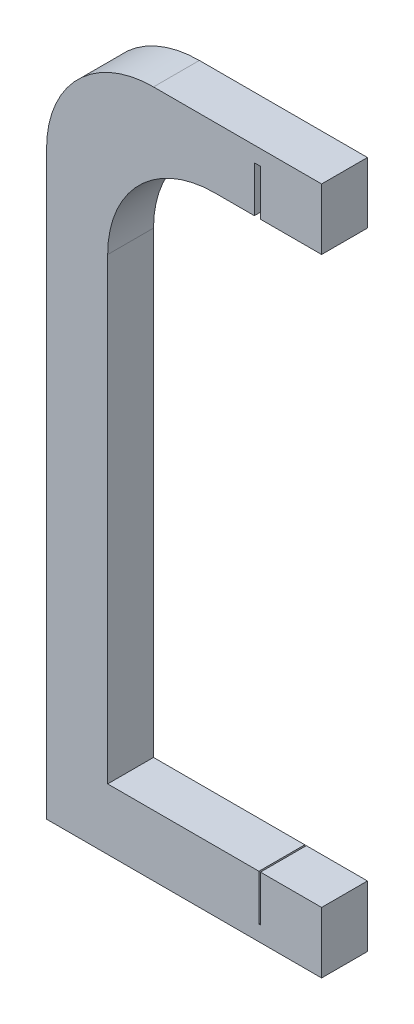
from build123d import *

# Parameters (mm, degrees)
BOSS_EXTRUDE1_DEPTH = 3
SKETCH3_W           = 0.1
SKETCH3_H           = 3
CUT_EXTRUDE1_DEPTH  = 3
SKETCH4_W           = 0.4
SKETCH4_H           = 3
CUT_EXTRUDE2_DEPTH  = 3


with BuildPart() as part:
    # Sketch1 → Boss-Extrude1 (new body)
    with BuildSketch(Plane.XY):
        with BuildLine():
            Line((0, 38), (0, 0))
            Line((0, 0), (18, 0))
            Line((18, 0), (18, 4))
            Line((18, 4), (4, 4))
            Line((4, 4), (4, 34))
            ThreePointArc((4, 34), (6.050252532, 38.949747468), (11, 41))
            Line((11, 41), (18, 41))
            Line((18, 41), (18, 45))
            Line((18, 45), (7, 45))
            ThreePointArc((7, 45), (2.050252532, 42.949747468), (0, 38))
        make_face()
    extrude(amount=BOSS_EXTRUDE1_DEPTH)

    # Sketch3 → Cut-Extrude1 (cut)
    with BuildSketch(Plane(origin=(0, 4, 0), x_dir=(1, 0, 0), z_dir=(0, 1, 0))):
        with Locations((13.95, -1.5)):
            Rectangle(SKETCH3_W, SKETCH3_H)
    extrude(amount=-CUT_EXTRUDE1_DEPTH, mode=Mode.SUBTRACT)

    # Sketch4 → Cut-Extrude2 (cut)
    with BuildSketch(Plane.XZ.offset(-41)):
        with Locations((13.8, 1.5)):
            Rectangle(SKETCH4_W, SKETCH4_H)
    extrude(amount=-CUT_EXTRUDE2_DEPTH, mode=Mode.SUBTRACT)


solid = part.part
